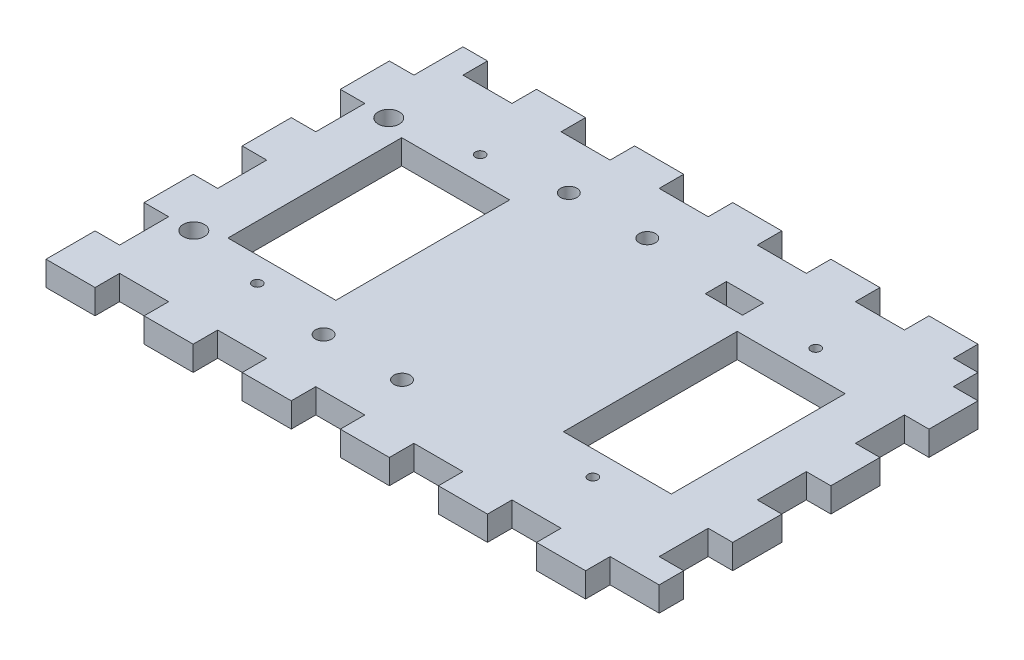
from build123d import *

# Parameters (mm, degrees)
SKETCH1_W                   = 152.4
SKETCH1_H                   = 101.6
BOSS_EXTRUDE2_DEPTH         = 6.35
SKETCH2_W                   = 6.35
SKETCH2_H                   = 12.7
CUT_EXTRUDE2_DEPTH          = 6.35
SKETCH2_4_W                 = 12.7
SKETCH2_4_H                 = 6.35
CUT_EXTRUDE3_DEPTH          = 6.35
SKETCH9_W                   = 27.94
SKETCH9_H                   = 45
CUT_EXTRUDE4_DEPTH          = 184.272045059
TAP_DRILL_FOR_M3X0_5_TAP1_D = 2.5
M5_CLEARANCE_HOLE5_D        = 5.5
TAP_DRILL_FOR_M5X0_8_TAP1_D = 4.2
SKETCH55_W                  = 9.652
SKETCH55_H                  = 5.461
CUT_EXTRUDE9_DEPTH          = 184.272045059


with BuildPart() as part:
    # Sketch1 → Boss-Extrude2 (new body)
    with BuildSketch(Plane(origin=(0, 0, 0), x_dir=(1, 0, 0), z_dir=(0, 1, 0))):
        with Locations((76.2, 50.8)):
            Rectangle(SKETCH1_W, SKETCH1_H)
    extrude(amount=BOSS_EXTRUDE2_DEPTH)

    # Sketch2 → Cut-Extrude2 (cut)
    with BuildSketch(Plane(origin=(0, 6.35, 0), x_dir=(1, 0, 0), z_dir=(0, 1, 0))):
        with Locations((3.175, 95.25)):
            Rectangle(SKETCH2_W, SKETCH2_H)
        with Locations((3.175, 69.85)):
            Rectangle(SKETCH2_W, SKETCH2_H)
        with Locations((3.175, 44.45)):
            Rectangle(SKETCH2_W, SKETCH2_H)
        with Locations((3.175, 19.05)):
            Rectangle(SKETCH2_W, SKETCH2_H)
    cut_extrude2 = extrude(amount=-CUT_EXTRUDE2_DEPTH, mode=Mode.SUBTRACT)

    # Mirror1: Cut-Extrude2 across plane
    add(cut_extrude2.mirror(Plane.ZY.offset(-76.2)), mode=Mode.SUBTRACT)

    # Sketch2<4> → Cut-Extrude3 (cut)
    with BuildSketch(Plane(origin=(0, 6.35, 0), x_dir=(1, 0, 0), z_dir=(0, 1, 0))):
        with Locations((19.05, 98.425)):
            Rectangle(SKETCH2_4_W, SKETCH2_4_H)
        with Locations((44.45, 98.425)):
            Rectangle(SKETCH2_4_W, SKETCH2_4_H)
        with Locations((69.85, 98.425)):
            Rectangle(SKETCH2_4_W, SKETCH2_4_H)
        with Locations((95.25, 98.425)):
            Rectangle(SKETCH2_4_W, SKETCH2_4_H)
        with Locations((146.05, 98.425)):
            Rectangle(SKETCH2_4_W, SKETCH2_4_H)
        with Locations((120.65, 98.425)):
            Rectangle(SKETCH2_4_W, SKETCH2_4_H)
    cut_extrude3 = extrude(amount=-CUT_EXTRUDE3_DEPTH, mode=Mode.SUBTRACT)

    # Mirror2: Cut-Extrude3 across plane
    add(cut_extrude3.mirror(Plane(origin=(0, 0, -50.8), x_dir=(1, 0, 0), z_dir=(0, 0, -1))), mode=Mode.SUBTRACT)

    # Sketch9 → Cut-Extrude4 (cut, through all)
    with BuildSketch(Plane(origin=(0, 6.35, 0), x_dir=(1, 0, 0), z_dir=(0, 1, 0))):
        with Locations((32.766, 50.8)):
            Rectangle(SKETCH9_W, SKETCH9_H)
        with Locations((119.634, 50.8)):
            Rectangle(SKETCH9_W, SKETCH9_H)
    extrude(amount=-CUT_EXTRUDE4_DEPTH, mode=Mode.SUBTRACT)

    # Tap Drill for M3x0.5 Tap1 (through all)
    with Locations(Plane(origin=(0, 6.35, 0), x_dir=(1, 0, 0), z_dir=(0, 1, 0))):
        with Locations((32.766, 79.65), (32.766, 21.95), (119.634, 21.95), (119.634, 79.65)):
            Hole(TAP_DRILL_FOR_M3X0_5_TAP1_D / 2)

    # M5 Clearance Hole5 (through all)
    with Locations(Plane(origin=(0, 6.35, 0), x_dir=(1, 0, 0), z_dir=(0, 1, 0))):
        with Locations((12.7, 76.04), (12.7, 25.56)):
            Hole(M5_CLEARANCE_HOLE5_D / 2)

    # Tap Drill for M5x0.8 Tap1 (through all)
    with Locations(Plane(origin=(0, 0, 0), x_dir=(-1, 0, 0), z_dir=(0, -1, 0))):
        with Locations((-73.126, 82.55), (-52.806, 82.55), (-73.126, 19.05), (-52.806, 19.05)):
            Hole(TAP_DRILL_FOR_M5X0_8_TAP1_D / 2)

    # Sketch55 → Cut-Extrude9 (cut, through all)
    with BuildSketch(Plane(origin=(0, 6.35, 0), x_dir=(1, 0, 0), z_dir=(0, 1, 0))):
        with Locations((97.90684, 80.3402)):
            Rectangle(SKETCH55_W, SKETCH55_H)
    extrude(amount=-CUT_EXTRUDE9_DEPTH, mode=Mode.SUBTRACT)


solid = part.part
